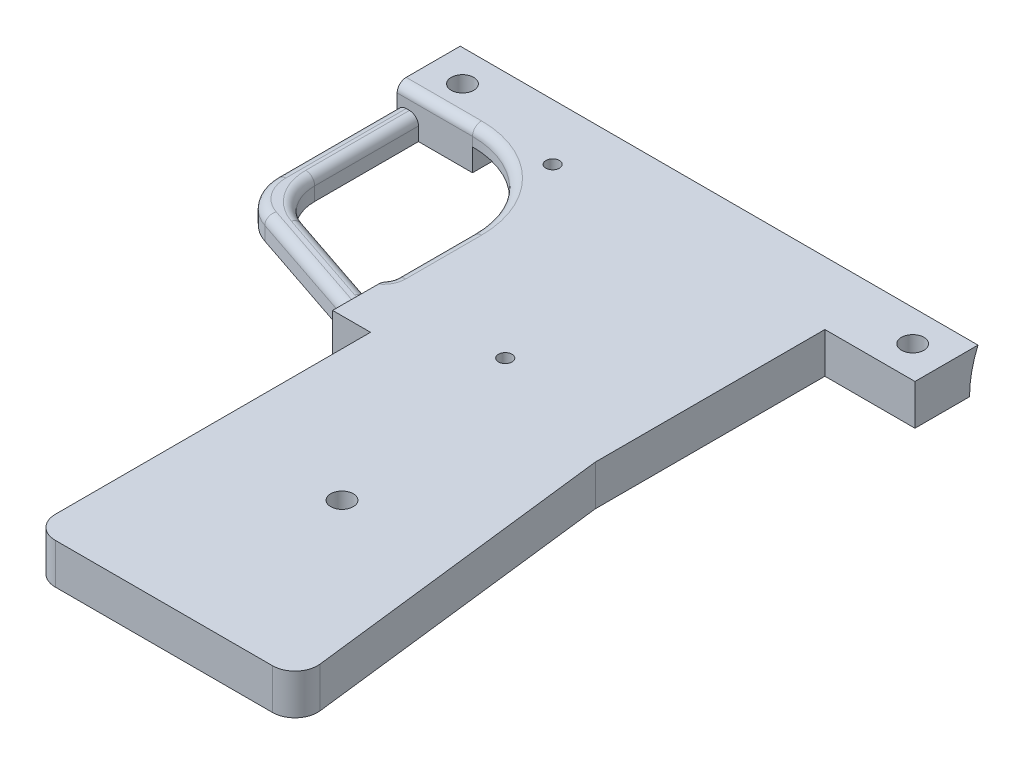
from build123d import *

# Parameters (mm, degrees)
SALIENTE_EXTRUIR1_DEPTH      = 4
REDONDEO1_R                  = 20
REDONDEO2_R                  = 10
REDONDEO3_R                  = 3
CROQUIS2_R                   = 1.5
CORTAR_EXTRUIR1_DEPTH        = 4
SALIENTE_EXTRUIR2_DEPTH      = 5
SALIENTE_EXTRUIR2_DEPTH_BACK = 4
CROQUIS4_W                   = 16.725121099
CROQUIS4_H                   = 14
SALIENTE_EXTRUIR3_DEPTH      = 5
SALIENTE_EXTRUIR4_DEPTH      = 5
CORTAR_EXTRUIR2_START        = -4
CORTAR_EXTRUIR2_DEPTH        = 4
SALIENTE_EXTRUIR5_DEPTH      = 9
REDONDEO4_R                  = 5
CORTAR_EXTRUIR3_DEPTH        = 115
CROQUIS10_R                  = 2.5
CORTAR_EXTRUIR4_DEPTH        = 10
REDONDEO5_R                  = 2


with BuildPart() as part:
    # Croquis1 → Saliente-Extruir1 (new body)
    with BuildSketch(Plane(origin=(0, 0, 0), x_dir=(1, 0, 0), z_dir=(0, 1, 0))):
        Polygon((36.657146199, 0.467319271), (95, 0.467319271), (95, 65.467319271), (0, 65.467319271), (0, 17.557539605), (36.657146199, 5.214366653), align=None)
        Polygon((4.725121099, 51.467319271), (36.725121099, 51.467319271), (36.725121099, 10.467319271), (4.725121099, 21.242340663), align=None, mode=Mode.SUBTRACT)
    extrude(amount=SALIENTE_EXTRUIR1_DEPTH)

    # Redondeo1
    redondeo1_edges = [part.edges().sort_by_distance(p)[0] for p in [
        (36.725121099, 2, -51.467319271),
    ]]
    fillet(redondeo1_edges, radius=REDONDEO1_R)

    # Redondeo2
    redondeo2_edges = [part.edges().sort_by_distance(p)[0] for p in [
        (0, 2, -17.557539605),
        (4.725121099, 2, -21.242340663),
    ]]
    fillet(redondeo2_edges, radius=REDONDEO2_R)

    # Redondeo3
    redondeo3_edges = [part.edges().sort_by_distance(p)[0] for p in [
        (36.725121099, 2, -10.467319271),
    ]]
    fillet(redondeo3_edges, radius=REDONDEO3_R)

    # Croquis2 → Cortar-Extruir1 (cut)
    with BuildSketch(Plane(origin=(0, 4, 0), x_dir=(1, 0, 0), z_dir=(0, 1, 0))):
        with Locations(Location((33, 53, 0), (0, 0, 270))):
            Circle(CROQUIS2_R)
        with Locations(Location((65, 10.467319271, 0), (0, 0, 270))):
            Circle(CROQUIS2_R)
    extrude(amount=-CORTAR_EXTRUIR1_DEPTH, mode=Mode.SUBTRACT)

    # Croquis3 → Saliente-Extruir2 (add, two sides: drawn at the far end of the back side and taken through both)
    with BuildSketch(Plane.XZ.offset(-SALIENTE_EXTRUIR2_DEPTH_BACK)):
        Polygon((95, -0.467319271), (95, -51.467319271), (115, -51.467319271), (115, -65.467319271), (85, -65.467319271), (85, -0.467319271), align=None)
    extrude(amount=SALIENTE_EXTRUIR2_DEPTH + SALIENTE_EXTRUIR2_DEPTH_BACK)

    # Croquis4 → Saliente-Extruir3 (add)
    with BuildSketch(Plane.XZ):
        with Locations((8.36256055, -58.467319271)):
            Rectangle(CROQUIS4_W, CROQUIS4_H)
    extrude(amount=SALIENTE_EXTRUIR3_DEPTH)

    # Croquis5 → Saliente-Extruir4 (add)
    with BuildSketch(Plane.XZ):
        with BuildLine():
            Line((6.808855565, -15.264865719), (36.657146199, -5.214366653))
            Line((36.657146199, -5.214366653), (36.657146199, -0.467319271))
            Line((36.657146199, -0.467319271), (46.657146199, -0.467319271))
            Line((46.657146199, -0.467319271), (46.657146199, -14.642982178))
            Line((46.657146199, -14.642982178), (36.725121099, -14.642982178))
            ThreePointArc((36.725121099, -14.642982178), (35.475545335, -12.206588327), (32.767777769, -11.799833616))
            Line((32.767777769, -11.799833616), (11.533976664, -18.949666776))
            ThreePointArc((11.533976664, -18.949666776), (6.603808263, -22.592081199), (4.725121099, -28.426828651))
            Line((4.725121099, -28.426828651), (4.725121099, -51.467319271))
            Line((4.725121099, -51.467319271), (0, -51.467319271))
            Line((0, -51.467319271), (0, -24.742027593))
            ThreePointArc((0, -24.742027593), (1.878687164, -18.907280142), (6.808855565, -15.264865719))
        make_face()
    extrude(amount=SALIENTE_EXTRUIR4_DEPTH)

    # Cortar-Extruir2: read off the stored shape, not the designer's step
    # Cortar-Extruir2 outline → Cortar-Extruir2 (cut)
    with BuildSketch(Plane(origin=(0, 4, 0), x_dir=(1, 0, 0), z_dir=(0, 1, 0)).offset(CORTAR_EXTRUIR2_START)):
        with BuildLine():
            Line((4.725121099, 51.467319271), (0, 51.467319271))
            Line((0, 51.467319271), (0, 24.742027593))
            ThreePointArc((0, 24.742027593), (1.878687164, 18.907280142), (6.808855565, 15.264865719))
            Line((6.808855565, 15.264865719), (36.657146199, 5.214366653))
            Line((36.657146199, 5.214366653), (36.72480926, 14.599727874))
            ThreePointArc((36.72480926, 14.599727874), (35.457935304, 12.194032416), (32.767777769, 11.799833616))
            Line((32.767777769, 11.799833616), (11.533976664, 18.949666776))
            ThreePointArc((11.533976664, 18.949666776), (6.603808263, 22.592081199), (4.725121099, 28.426828651))
            Line((4.725121099, 28.426828651), (4.725121099, 51.467319271))
        make_face()
    extrude(amount=CORTAR_EXTRUIR2_DEPTH, mode=Mode.SUBTRACT)

    # Croquis8 → Saliente-Extruir5 (add)
    with BuildSketch(Plane(origin=(0, 4, 0), x_dir=(1, 0, 0), z_dir=(0, 1, 0))):
        Polygon((45.08, -74.552680729), (103.96, -74.552680729), (95, 0.467319271), (45.08, 0.467319271), align=None)
    extrude(amount=-SALIENTE_EXTRUIR5_DEPTH)

    # Redondeo4
    redondeo4_edges = [part.edges().sort_by_distance(p)[0] for p in [
        (45.08, -0.5, 74.552680729),
        (103.96, -0.5, 74.552680729),
    ]]
    fillet(redondeo4_edges, radius=REDONDEO4_R)

    # Croquis9 → Cortar-Extruir3 (cut)
    with BuildSketch(Plane(origin=(115, 0, 0), x_dir=(0, 0, -1), z_dir=(1, 0, 0))):
        with BuildLine():
            Line((65.467319271, 4), (65.467319271, -5))
            Line((65.467319271, -5), (63.588909898, -5))
            ThreePointArc((63.588909898, -5), (64.063517857, -0.403033017), (65.467319271, 4))
        make_face()
    extrude(amount=-CORTAR_EXTRUIR3_DEPTH, mode=Mode.SUBTRACT)

    # Croquis10 → Cortar-Extruir4 (cut)
    with BuildSketch(Plane(origin=(0, 4, 0), x_dir=(1, 0, 0), z_dir=(0, 1, 0))):
        with Locations(Location((7.5, 58.467319271, 0), (0, 0, 270))):
            Circle(CROQUIS10_R)
        with Locations(Location((107.5, 58.467319271, 0), (0, 0, 270))):
            Circle(CROQUIS10_R)
        with Locations(Location((74.21, -35, 0), (0, 0, 270))):
            Circle(CROQUIS10_R)
    extrude(amount=-CORTAR_EXTRUIR4_DEPTH, mode=Mode.SUBTRACT)

    # Redondeo5
    # the kernel refuses this fillet: 2 mm, written as the material it takes off along each edge
    with BuildSketch(Plane(origin=(6.808855565, 0, -15.264865719), x_dir=(-3.003248393768829e-11, -1.0, 8.919142254990751e-11), z_dir=(0.9477161874303269, 0, 0.31911444355046886))) as redondeo5_piece_1_section:
        with BuildLine():
            CenterArc((REDONDEO5_R, REDONDEO5_R), REDONDEO5_R, 180.000000005, 90)
            Line((-REDONDEO5_R * 9.41119543218e-11, REDONDEO5_R), (0, 0))
            Line((0, 0), (REDONDEO5_R, 0))
        make_face()
    redondeo5_piece_1 = extrude(amount=36.494967618, mode=Mode.PRIVATE)
    redondeo5_piece_1 = split(redondeo5_piece_1, bisect_by=Plane(origin=(36.728049447, 0, -15.049165525), z_dir=(-0.9999740131061556, 0, -0.007209237988178882)), keep=Keep.TOP, mode=Mode.PRIVATE)
    add(redondeo5_piece_1, mode=Mode.SUBTRACT)
    with BuildSketch(Plane(origin=(9.999999999, 0, -24.742027593), x_dir=(-1.0, 0, 6.147260478780798e-12), z_dir=(-6.147260478780798e-12, 0, -1.0))) as redondeo5_piece_2:
        with BuildLine():
            CenterArc((9.999999999 - REDONDEO5_R, -REDONDEO5_R), REDONDEO5_R, 0, 90)
            Line((9.999999999 + REDONDEO5_R * 5.85513859619e-11, -REDONDEO5_R), (9.999999999, 0))
            Line((9.999999999, 0), (9.999999999 - REDONDEO5_R, 0))
        make_face()
    revolve(axis=Axis((9.999999999, 0, -24.742027593), (0, 1, 0)), revolution_arc=71.390621361, mode=Mode.SUBTRACT)
    with BuildSketch(Plane(origin=(0, 0, -51.467319271), x_dir=(0, -1, 0), z_dir=(0, 0, 1))) as redondeo5_piece_3:
        with BuildLine():
            CenterArc((REDONDEO5_R, REDONDEO5_R), REDONDEO5_R, 180, 90)
            Line((0, REDONDEO5_R), (0, 0))
            Line((0, 0), (REDONDEO5_R, 0))
        make_face()
    extrude(amount=26.725291678, mode=Mode.SUBTRACT)
    with BuildSketch(Plane(origin=(4.725121099, 0, -28.426828651), x_dir=(-1, 0, 0), z_dir=(0, 0, -1))) as redondeo5_piece_4:
        with BuildLine():
            CenterArc((REDONDEO5_R, -REDONDEO5_R), REDONDEO5_R, 90, 90)
            Line((-REDONDEO5_R * 1.16604059741e-10, -REDONDEO5_R), (0, 0))
            Line((0, 0), (REDONDEO5_R, 0))
        make_face()
    extrude(amount=23.04049062, mode=Mode.SUBTRACT)
    with BuildSketch(Plane(origin=(14.725121098, 0, -28.42682865), x_dir=(-0.3191144434609787, 0, 0.94771618746046), z_dir=(0.94771618746046, 0, 0.3191144434609787))) as redondeo5_piece_5:
        with BuildLine():
            CenterArc((9.999999999 + REDONDEO5_R, REDONDEO5_R), REDONDEO5_R, 180, 90)
            Line((9.999999999 - REDONDEO5_R * 2.13431938789e-10, REDONDEO5_R), (9.999999999, 0))
            Line((9.999999999, 0), (9.999999999 + REDONDEO5_R, 0))
        make_face()
    revolve(axis=Axis((14.725121098, 0, -28.42682865), (0, -1, 0)), revolution_arc=71.390621366, mode=Mode.SUBTRACT)
    with BuildSketch(Plane(origin=(32.767777769, 0, -11.799833616), x_dir=(-0.3191144435113306, 0, 0.9477161874435055), z_dir=(-0.9477161874435056, 0, -0.3191144435113306))) as redondeo5_piece_6:
        with BuildLine():
            CenterArc((REDONDEO5_R, -REDONDEO5_R), REDONDEO5_R, 90, 90)
            Line((0, -REDONDEO5_R), (0, 0))
            Line((0, 0), (REDONDEO5_R, 0))
        make_face()
    extrude(amount=22.405232058, mode=Mode.SUBTRACT)
    with BuildSketch(Plane(origin=(33.725121101, 0, -14.642982175), x_dir=(-0.08231883672192833, 0, -0.996606045095427), z_dir=(-0.996606045095427, 0, 0.08231883672192833))) as redondeo5_piece_7_section:
        with BuildLine():
            CenterArc((2.999999998 + REDONDEO5_R, REDONDEO5_R), REDONDEO5_R, 180, 90)
            Line((2.999999998 + REDONDEO5_R, 0), (2.999999998, 0))
            Line((2.999999998, 0), (2.999999998 - REDONDEO5_R * 4.36447322727e-10, REDONDEO5_R))
        make_face()
    redondeo5_piece_7 = revolve(axis=Axis((33.725121101, 0, -14.642982175), (0, -1, 0)), revolution_arc=203.331243748, mode=Mode.PRIVATE)
    redondeo5_piece_7 = split(redondeo5_piece_7, bisect_by=Plane(origin=(36.724965179, 0, -14.621355023), z_dir=(-0.9999740131061556, 0, -0.007209237988178882)), keep=Keep.TOP, mode=Mode.PRIVATE)
    add(redondeo5_piece_7, mode=Mode.SUBTRACT)
    with BuildSketch(Plane(origin=(4.725121099, 4, -51.467319271), x_dir=(0, 0, -1), z_dir=(1, 0, 0))) as redondeo5_piece_8:
        with BuildLine():
            CenterArc((REDONDEO5_R, -REDONDEO5_R), REDONDEO5_R, 90, 90)
            Line((0, -REDONDEO5_R), (0, 0))
            Line((0, 0), (REDONDEO5_R, 0))
        make_face()
    extrude(amount=12, mode=Mode.SUBTRACT)
    with BuildSketch(Plane(origin=(16.725121099, 4, -31.467319271), x_dir=(0, 0, -1), z_dir=(-1, 0, 0))) as redondeo5_piece_9:
        with BuildLine():
            CenterArc((20 + REDONDEO5_R, REDONDEO5_R), REDONDEO5_R, 180, 90)
            Line((20, REDONDEO5_R), (20, 0))
            Line((20, 0), (20 + REDONDEO5_R, 0))
        make_face()
    revolve(axis=Axis((16.725121099, 4, -31.467319271), (0, -1, 0)), revolution_arc=90, mode=Mode.SUBTRACT)
    with BuildSketch(Plane(origin=(36.725121099, 4, -31.467319271), x_dir=(1, 0, 0), z_dir=(0, 0, 1))) as redondeo5_piece_10:
        with BuildLine():
            CenterArc((REDONDEO5_R, -REDONDEO5_R), REDONDEO5_R, 90, 90)
            Line((0, -REDONDEO5_R), (0, 0))
            Line((0, 0), (REDONDEO5_R, 0))
        make_face()
    extrude(amount=16.824337093, mode=Mode.SUBTRACT)
    with BuildSketch(Plane(origin=(33.725121099, 4, -14.642982178), x_dir=(-0.11006554678443577, 0, 0.9939243308275753), z_dir=(-0.9939243308275753, 0, -0.11006554678443577))) as redondeo5_piece_11:
        with BuildLine():
            CenterArc((3 + REDONDEO5_R, -REDONDEO5_R), REDONDEO5_R, 90, 90)
            Line((3, -REDONDEO5_R), (3, 0))
            Line((3, 0), (3 + REDONDEO5_R, 0))
        make_face()
    revolve(axis=Axis((33.725121099, 4, -14.642982178), (0, 1, 0)), revolution_arc=96.319094067, mode=Mode.SUBTRACT)
    with BuildSketch(Plane(origin=(4.725121099, 4, -51.467319271), x_dir=(0, 0, -1), z_dir=(-1, 0, 0))) as redondeo5_piece_12:
        with BuildLine():
            CenterArc((REDONDEO5_R, REDONDEO5_R), REDONDEO5_R, 180, 90)
            Line((-REDONDEO5_R * 1.79170456249e-10, REDONDEO5_R), (0, 0))
            Line((0, 0), (REDONDEO5_R, 0))
        make_face()
    extrude(amount=9.725121099, mode=Mode.SUBTRACT)


solid = part.part
